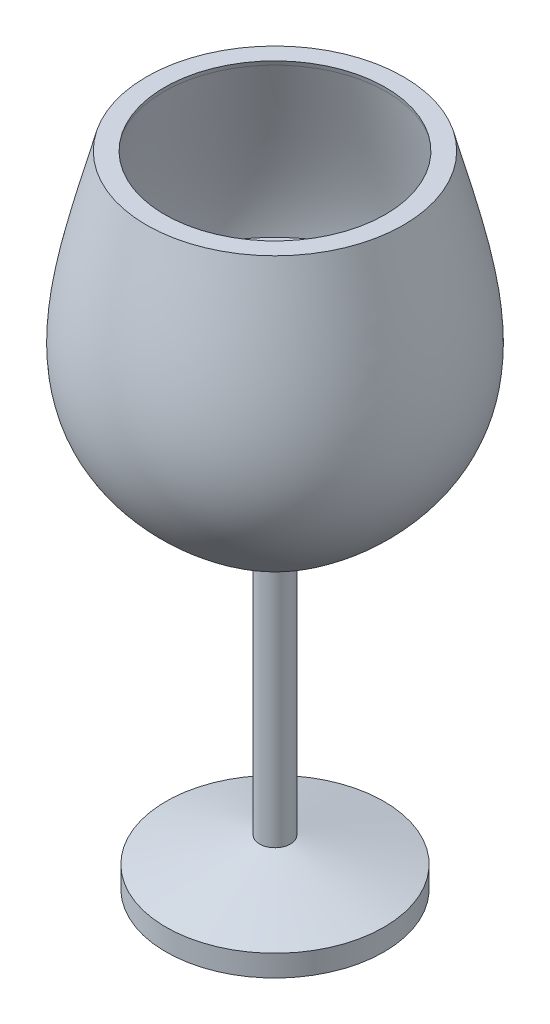
from build123d import *


# Read off the part's stored shape, not the designer's step: Cut-Revolve1
with BuildPart() as part:
    # Sketch2 → Revolve1 (revolve)
    with BuildSketch(Plane.XY):
        with BuildLine():
            Line((2.631253823, -46.562458286), (2.631253823, -4.736256881))
            add(Edge.make_bspline(
                [(2.631253823, -4.736256881), (34.471117499, 12.018970529), (29.443053516, 26.193716055), (21.917928882, 54.523597031)],
                knots=[0, 0, 0, 0, 1, 1, 1, 1], degree=3))
            Line((21.917928882, 54.523597031), (0, 54.523597031))
            Line((0, 54.523597031), (0, -54.523597031))
            Line((0, -54.523597031), (18.594871216, -54.523597031))
            Line((18.594871216, -54.523597031), (18.594871216, -50.861683976))
            Line((18.594871216, -50.861683976), (2.631253823, -46.562458286))
        make_face()
    revolve(axis=Axis((0, -54.523597031, 0), (0, 1, 0)))

    # Cut-Revolve1 outline → Cut-Revolve1 (revolve, cut)
    with BuildSketch(Plane.XY):
        with BuildLine():
            add(Edge.make_bspline(
                [(18.020471145, 9.738037596), (13.232269499, 4.62684716), (6.786495281, 2.171739839), (0, 2.171739839)],
                knots=[0.001429836, 0.001429836, 0.001429836, 0.001429836, 1, 1, 1, 1], degree=3))
            add(Edge.make_bspline(
                [(18.020471145, 9.738037596), (18.490068509, 10.239614321), (19.492455887, 11.381389394), (21.969134176, 14.711204078), (24.39185026, 20.213899803), (24.772115374, 28.28587885), (23.422813446, 36.692884797), (21.327912764, 45.171242003), (19.776816311, 50.899250576), (19.018524326, 53.75323788)],
                knots=[0.304443695, 0.304443695, 0.304443695, 0.304443695, 0.336156678, 0.375, 0.5, 0.625, 0.75, 0.875, 1, 1, 1, 1], degree=3))
            Line((19.018524326, 53.75323788), (18.813843258, 54.523597031))
            Line((18.813843258, 54.523597031), (0, 54.523597031))
            Line((0, 54.523597031), (0, 2.171739839))
        make_face()
    revolve(axis=Axis((0, 0, 0), (0, 1, 0)), mode=Mode.SUBTRACT)


with BuildPart() as body_2:
    # Sketch5 → Revolve2 (revolve)
    with BuildSketch(Plane.XY):
        with BuildLine():
            Line((24.49790326, 24.433071211), (0, 24.433071211))
            Line((0, 24.433071211), (0, 2.171739839))
            add(Edge.make_bspline(
                [(18.02047452, 9.738034434), (13.232271308, 4.626844539), (6.786495937, 2.171738373), (0, 2.171739839)],
                knots=[0, 0, 0, 0, 1, 1, 1, 1], degree=3))
            add(Edge.make_bspline(
                [(18.02047452, 9.738034434), (18.490068509, 10.239614321), (19.492455887, 11.381389394), (21.969134176, 14.711204078), (23.888170898, 19.069896885), (24.417216372, 23.045719749), (24.49790326, 24.433071211)],
                knots=[0, 0, 0, 0, 0.045593697, 0.101438668, 0.281150935, 0.374529239, 0.374529239, 0.374529239, 0.374529239], degree=3))
        make_face()
    revolve(axis=Axis((0, 24.433071211, 0), (0, -1, 0)))


solid = Compound([part.part, body_2.part])
